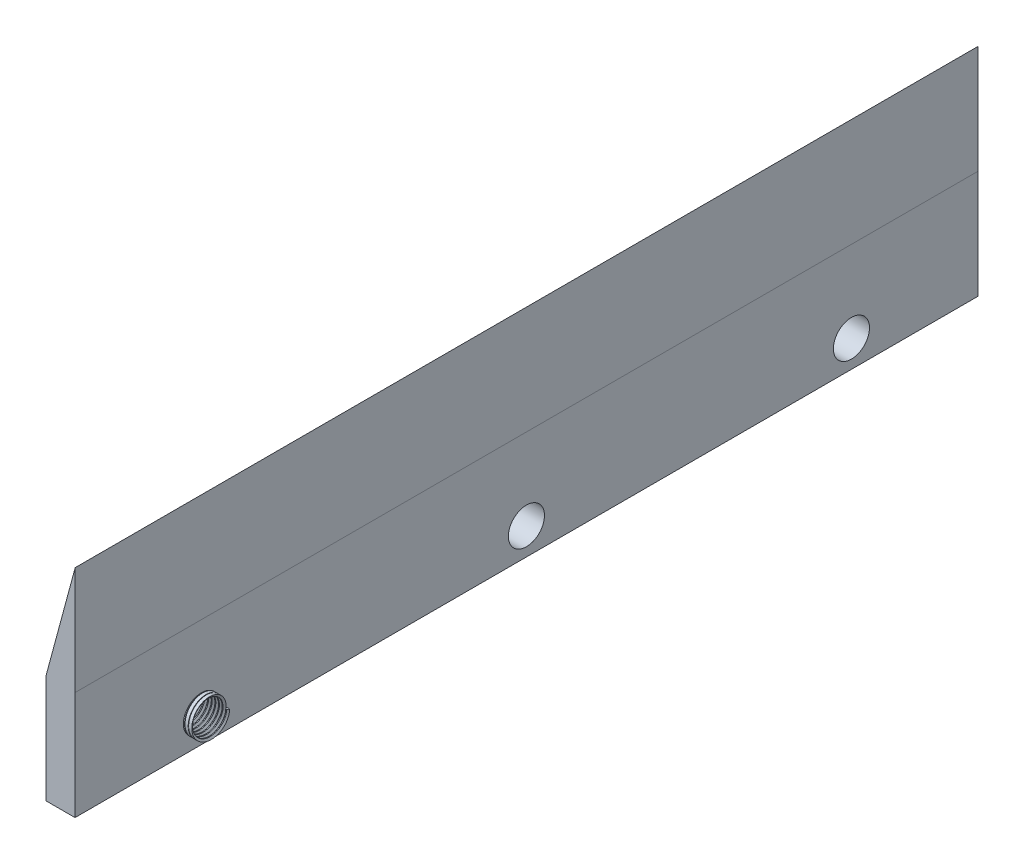
from build123d import *

# Parameters (mm, degrees)
EXTRUDE_1_DEPTH     = 250
SKETCH_2_R          = 5
CUT_EXTRUDE_1_DEPTH = 350.148180816
THREAD_1_PITCH      = 1


with BuildPart() as part:
    # Sketch 1 → 填料-伸長1 (new body)
    with BuildSketch(Plane.XY):
        Polygon((-16.42669399, 183.61003592), (-24.465157515, 183.61003592), (-24.465157515, 213.61003592), (-16.374323704, 243.595957634), (-16.42669399, 213.596003344), align=None)
    extrude(amount=EXTRUDE_1_DEPTH)

    # 草圖2 → 除料-伸長1 (cut, through all)
    with BuildSketch(Plane(origin=(-24.465157515, 0, 0), x_dir=(0, 0, -1), z_dir=(1, 0, 0))):
        with Locations(Location((-215, 191.066951459, 0), (0, 0, 270))):
            Circle(SKETCH_2_R)
        with Locations(Location((-125, 191.066951459, 0), (0, 0, 270))):
            Circle(SKETCH_2_R)
        with Locations(Location((-35, 191.066951459, 0), (0, 0, 270))):
            Circle(SKETCH_2_R)
    extrude(amount=CUT_EXTRUDE_1_DEPTH, mode=Mode.SUBTRACT)

    # 螺紋1: the profile of Sketch 1 2 profile screwed along a right-hand helix of 10 turns, 8 arcs to a turn; built about Z, then put on its axis
    thread_1_z = Axis((0, 0, 0), (0, 0, 1))
    thread_1_corners = [(5.0003, 0, -0.000173205), (5.0003, 0, 0.875173202), (4.458734125, 0, 0.562499999), (4.458734125, 0, 0.312499999)]
    with BuildLine(mode=Mode.PRIVATE) as thread_1_profile:
        Line(thread_1_corners[0], thread_1_corners[1])
        Line(thread_1_corners[1], thread_1_corners[2])
        Line(thread_1_corners[2], thread_1_corners[3])
        Line(thread_1_corners[3], thread_1_corners[0])
    thread_1_cap = Face(thread_1_profile.wire())
    thread_1_turn_angles = [0, 22.5, 45, 67.5, 90, 112.5, 135, 157.5, 180, 202.5, 225, 247.5, 270, 292.5, 315, 337.5, 360]
    thread_1_turn_weights = [1, 0.9238795325112867, 1, 0.9238795325112867, 1, 0.9238795325112867, 1, 0.9238795325112867, 1, 0.9238795325112867, 1, 0.9238795325112867, 1, 0.9238795325112867, 1, 0.9238795325112867, 1]
    thread_1_turn_rails = [Edge.make_bspline([Vector(p[0], p[1], 0).rotate(thread_1_z, thread_1_turn_angles[k]) / thread_1_turn_weights[k] + Vector(0, 0, p[2] + THREAD_1_PITCH * thread_1_turn_angles[k] / 360) for k in range(17)], [0, 0, 0, 1, 1, 2, 2, 3, 3, 4, 4, 5, 5, 6, 6, 7, 7, 8, 8, 8], 2, thread_1_turn_weights) for p in thread_1_corners]
    thread_1_turn_sides = [Face.make_surface_from_curves(thread_1_turn_rails[p[0]], thread_1_turn_rails[p[1]]) for p in [(0, 1), (1, 2), (2, 3), (3, 0)]]
    thread_1 = Plane(origin=(-24.465157515, 191.066951459, 215), x_dir=(0, 0, -1), z_dir=(1, 0, 0)) * Solid(Shell([*[p.moved(Location((0, 0, THREAD_1_PITCH * i))) for i in range(10) for p in thread_1_turn_sides], thread_1_cap, thread_1_cap.rotate(thread_1_z, 3600).moved(Location((0, 0, THREAD_1_PITCH * 3600 / 360)))]))
    add(thread_1)


solid = part.part
